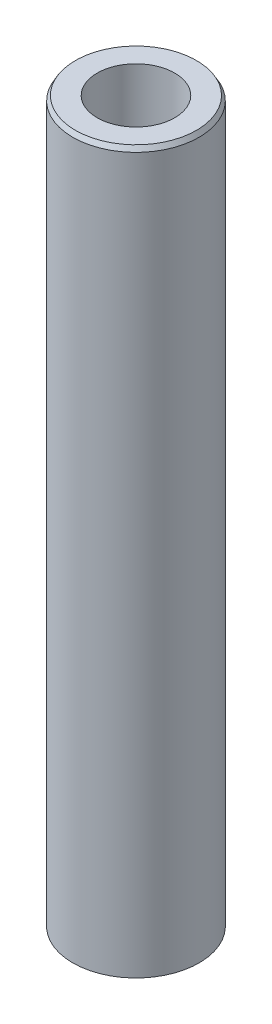
from build123d import *
from OCP.BRepFilletAPI import BRepFilletAPI_MakeChamfer

# Parameters (mm, degrees)
SKETCH1_R           = 52.5
BOSS_EXTRUDE1_DEPTH = 600
SKETCH2_R           = 32.197820431
CUT_EXTRUDE1_DEPTH  = 605.576297914
CHAMFER1_SIZE       = 3.864774123
CHAMFER1_SIZE2      = 2.231328381


with BuildPart() as part:
    # Sketch1 → Boss-Extrude1 (new body)
    with BuildSketch(Plane(origin=(0, 0, 0), x_dir=(1, 0, 0), z_dir=(0, 1, 0))):
        Circle(SKETCH1_R)
    extrude(amount=BOSS_EXTRUDE1_DEPTH)

    # Sketch2 → Cut-Extrude1 (cut, through all)
    with BuildSketch(Plane(origin=(0, 0, 0), x_dir=(1, 0, 0), z_dir=(0, 1, 0))):
        Circle(SKETCH2_R)
    extrude(amount=CUT_EXTRUDE1_DEPTH, mode=Mode.SUBTRACT)

    # Chamfer1: one chamfer whose edges measure the first distance from different faces: ONE call of the kernel's chamfer builder (chamfer() names one face for all edges)
    chamfer1_edges_1 = [part.edges().sort_by_distance(p)[0] for p in [
        (-52.5, 600, 0),
    ]]
    chamfer1_side_1 = [part.faces().sort_by_distance(p)[0] for p in [
        (-52.5, 300, 0),
    ]]
    chamfer1_edges_2 = [part.edges().sort_by_distance(p)[0] for p in [
        (-52.5, 0, 0),
    ]]
    chamfer1_side_2 = [part.faces().sort_by_distance(p)[0] for p in [
        (-51.01507576, 0, 0),
    ]]
    chamfer1 = BRepFilletAPI_MakeChamfer(part.part.solid().wrapped)
    for e in chamfer1_edges_1:
        chamfer1.Add(CHAMFER1_SIZE, CHAMFER1_SIZE2, e.wrapped, chamfer1_side_1[0].wrapped)  # the first distance lies on this face
    for e in chamfer1_edges_2:
        chamfer1.Add(CHAMFER1_SIZE, CHAMFER1_SIZE2, e.wrapped, chamfer1_side_2[0].wrapped)  # the first distance lies on this face
    add(Compound.cast(chamfer1.Shape()), mode=Mode.REPLACE)


solid = part.part
